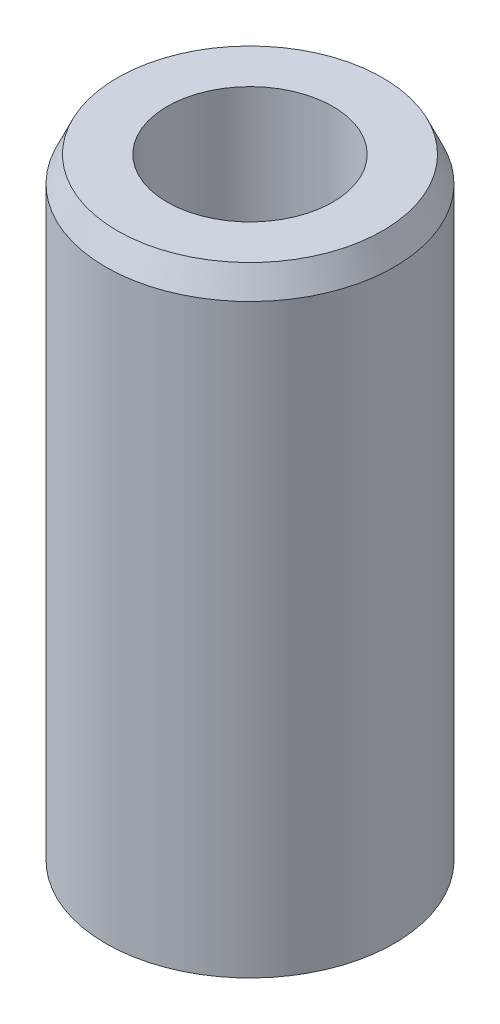
from build123d import *
from OCP.BRepFilletAPI import BRepFilletAPI_MakeChamfer

# Parameters (mm, degrees)
SKETCH1_R           = 15
BOSS_EXTRUDE1_DEPTH = 64.780779988
SKETCH2_R           = 8.618697403
CUT_EXTRUDE1_DEPTH  = 69.165603172
CHAMFER1_SIZE       = 2.655577651
CHAMFER1_SIZE2      = 1.210923799


with BuildPart() as part:
    # Sketch1 → Boss-Extrude1 (new body)
    with BuildSketch(Plane(origin=(0, 0, 0), x_dir=(1, 0, 0), z_dir=(0, 1, 0))):
        Circle(SKETCH1_R)
    extrude(amount=BOSS_EXTRUDE1_DEPTH)

    # Sketch2 → Cut-Extrude1 (cut, through all)
    with BuildSketch(Plane(origin=(0, 0, 0), x_dir=(1, 0, 0), z_dir=(0, 1, 0))):
        Circle(SKETCH2_R)
    extrude(amount=CUT_EXTRUDE1_DEPTH, mode=Mode.SUBTRACT)

    # Chamfer1: one chamfer whose edges measure the first distance from different faces: ONE call of the kernel's chamfer builder (chamfer() names one face for all edges)
    chamfer1_edges_1 = [part.edges().sort_by_distance(p)[0] for p in [
        (-15, 64.780779988, 0),
    ]]
    chamfer1_side_1 = [part.faces().sort_by_distance(p)[0] for p in [
        (-15, 32.390389994, 0),
    ]]
    chamfer1_edges_2 = [part.edges().sort_by_distance(p)[0] for p in [
        (-15, 0, 0),
    ]]
    chamfer1_side_2 = [part.faces().sort_by_distance(p)[0] for p in [
        (-14.575735931, 0, 0),
    ]]
    chamfer1 = BRepFilletAPI_MakeChamfer(part.part.solid().wrapped)
    for e in chamfer1_edges_1:
        chamfer1.Add(CHAMFER1_SIZE, CHAMFER1_SIZE2, e.wrapped, chamfer1_side_1[0].wrapped)  # the first distance lies on this face
    for e in chamfer1_edges_2:
        chamfer1.Add(CHAMFER1_SIZE, CHAMFER1_SIZE2, e.wrapped, chamfer1_side_2[0].wrapped)  # the first distance lies on this face
    add(Compound.cast(chamfer1.Shape()), mode=Mode.REPLACE)


solid = part.part
